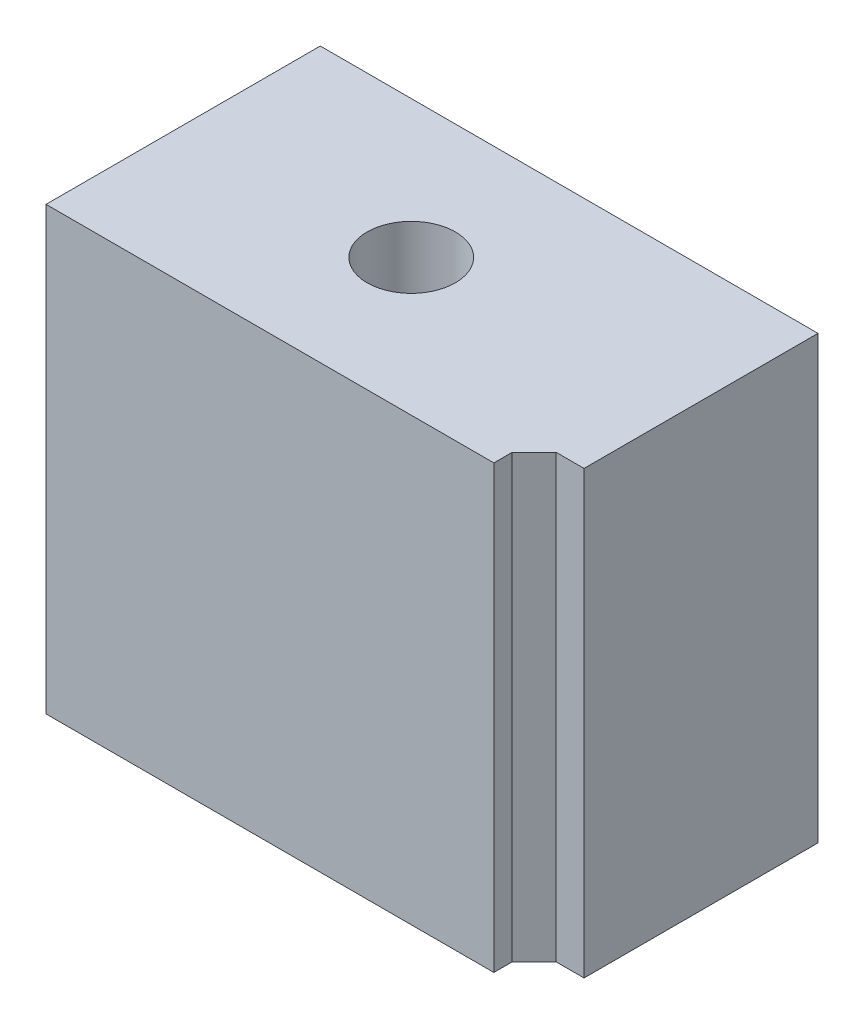
from build123d import *

# Parameters (mm, degrees)
SKETCH3_W           = 112.775418125
SKETCH3_H           = 62.141556926
BOSS_EXTRUDE1_DEPTH = 100
SKETCH4_W           = 11.300404478
SKETCH4_H           = 9.134771786
CUT_EXTRUDE1_DEPTH  = 100
CHAMFER2_SIZE       = 5
SKETCH5_R           = 10
CUT_EXTRUDE2_DEPTH  = 100


with BuildPart() as part:
    # Sketch3 → Boss-Extrude1 (new body)
    with BuildSketch(Plane(origin=(0, 0, 0), x_dir=(1, 0, 0), z_dir=(0, 1, 0))):
        with Locations((4.603078291, 0.095897464)):
            Rectangle(SKETCH3_W, SKETCH3_H)
    extrude(amount=BOSS_EXTRUDE1_DEPTH)

    # Sketch4 → Cut-Extrude1 (cut)
    with BuildSketch(Plane(origin=(0, 100, 0), x_dir=(1, 0, 0), z_dir=(0, 1, 0))):
        with Locations((55.340585114, -26.407495106)):
            Rectangle(SKETCH4_W, SKETCH4_H)
    extrude(amount=-CUT_EXTRUDE1_DEPTH, mode=Mode.SUBTRACT)

    # Chamfer2
    chamfer2_edges = [part.edges().sort_by_distance(p)[0] for p in [
        (49.690382875, 50, 21.840109213),
    ]]
    chamfer(chamfer2_edges, length=CHAMFER2_SIZE)

    # Sketch5 → Cut-Extrude2 (cut)
    with BuildSketch(Plane(origin=(0, 100, 0), x_dir=(1, 0, 0), z_dir=(0, 1, 0))):
        Circle(SKETCH5_R)
    extrude(amount=-CUT_EXTRUDE2_DEPTH, mode=Mode.SUBTRACT)


solid = part.part
